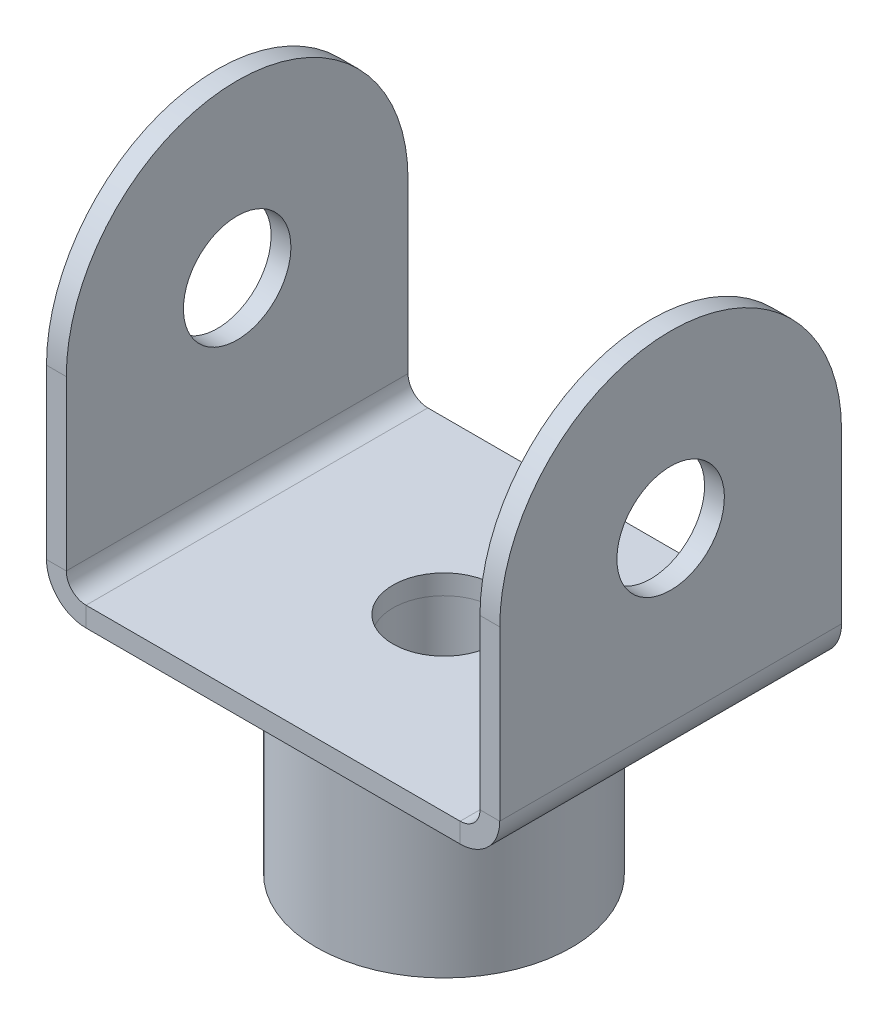
from build123d import *

# Parameters (mm, degrees)
SKETCH1_R                    = 4.75
SKETCH1_R_2                  = 1.9
BOSS_EXTRUDE1_DEPTH          = 7.62
SKETCH2_W                    = 14.87
SKETCH2_H                    = 12.72
SKETCH2_R                    = 1.9
BASE_FLANGE1_DEPTH           = 0.7366
EDGE_FLANGE1_STRIP_W         = 5.4196
EDGE_FLANGE1_STRIP_H         = 0.7366
EDGE_FLANGE1_STRIP_CUT_DEPTH = 12.72
EDGE_FLANGE1_DEPTH           = 12.72
EDGE_FLANGE1_PROFILE_R       = 2
EDGE_FLANGE1_FLAT_DEPTH      = 0.7366


# Sheet-metal steps are written as plain solids
with BuildPart() as part:
    # Sketch1 → Boss-Extrude1 (new body)
    with BuildSketch(Plane(origin=(0, 0, 0), x_dir=(1, 0, 0), z_dir=(0, 1, 0))):
        with Locations(Location((0, 0, 0), (0, 0, 270))):
            Circle(SKETCH1_R)
        with Locations(Location((0, 0, 0), (0, 0, 270))):
            Circle(SKETCH1_R_2, mode=Mode.SUBTRACT)
    extrude(amount=BOSS_EXTRUDE1_DEPTH)


with BuildPart() as body_2:
    # Sketch2 → Base-Flange1 (new body)
    with BuildSketch(Plane(origin=(0, 7.62, 0), x_dir=(1, 0, 0), z_dir=(0, 1, 0))):
        Rectangle(SKETCH2_W, SKETCH2_H)
        with Locations(Location((0, 0, 0), (0, 0, 270))):
            Circle(SKETCH2_R, mode=Mode.SUBTRACT)
    extrude(amount=BASE_FLANGE1_DEPTH)

    # Edge-Flange1 strip (across the edge) → Edge-Flange1 strip cut (cut)
    with BuildSketch(Plane(origin=(-8.435, 8.3566, -6.36), x_dir=(1, 0, 0), z_dir=(0, 0, 1))):
        with Locations((-1.2366, -0.3683)):
            Rectangle(EDGE_FLANGE1_STRIP_W, EDGE_FLANGE1_STRIP_H)
    edge_flange1_strip_cut = extrude(amount=EDGE_FLANGE1_STRIP_CUT_DEPTH, mode=Mode.SUBTRACT)

    # Edge-Flange1 bend section (across the edge) → Edge-Flange1 (add)
    with BuildSketch(Plane(origin=(-8.435, 8.3566, -6.36), x_dir=(1, 0, 0), z_dir=(0, 0, 1))):
        with BuildLine():
            Line((0, 0.7366), (0.7366, 0.7366))
            ThreePointArc((0.7366, 0.7366), (0.952345145, 0.215745145), (1.4732, 0))
            Line((1.4732, 0), (1.4732, -0.7366))
            ThreePointArc((1.4732, -0.7366), (0.43149029, -0.30510971), (0, 0.7366))
        make_face()
    edge_flange1 = extrude(amount=EDGE_FLANGE1_DEPTH)

    # Edge-Flange1 profile (on flange) → Edge-Flange1 flat (add)
    with BuildSketch(Plane(origin=(-8.435, 8.3566, 0), x_dir=(0, 0, 1), z_dir=(-1, 0, 0))):
        with BuildLine():
            ThreePointArc((6.36, 7), (0, 13.36), (-6.36, 7))
            Line((-6.36, 7), (-6.36, 0.7366))
            Line((-6.36, 0.7366), (6.36, 0.7366))
            Line((6.36, 0.7366), (6.36, 7))
        make_face()
        with Locations((0, 7)):
            Circle(EDGE_FLANGE1_PROFILE_R, mode=Mode.SUBTRACT)
    edge_flange1_flat = extrude(amount=-EDGE_FLANGE1_FLAT_DEPTH)

    # Mirror1: Edge-Flange1 strip cut, Edge-Flange1, Edge-Flange1 flat across plane
    add(edge_flange1_strip_cut.mirror(Plane(origin=(0, 0, 0), x_dir=(0, 0, 1), z_dir=(1, 0, 0))), mode=Mode.SUBTRACT)
    add(edge_flange1.mirror(Plane(origin=(0, 0, 0), x_dir=(0, 0, 1), z_dir=(1, 0, 0))))
    add(edge_flange1_flat.mirror(Plane(origin=(0, 0, 0), x_dir=(0, 0, 1), z_dir=(1, 0, 0))))


solid = Compound([part.part, body_2.part])
